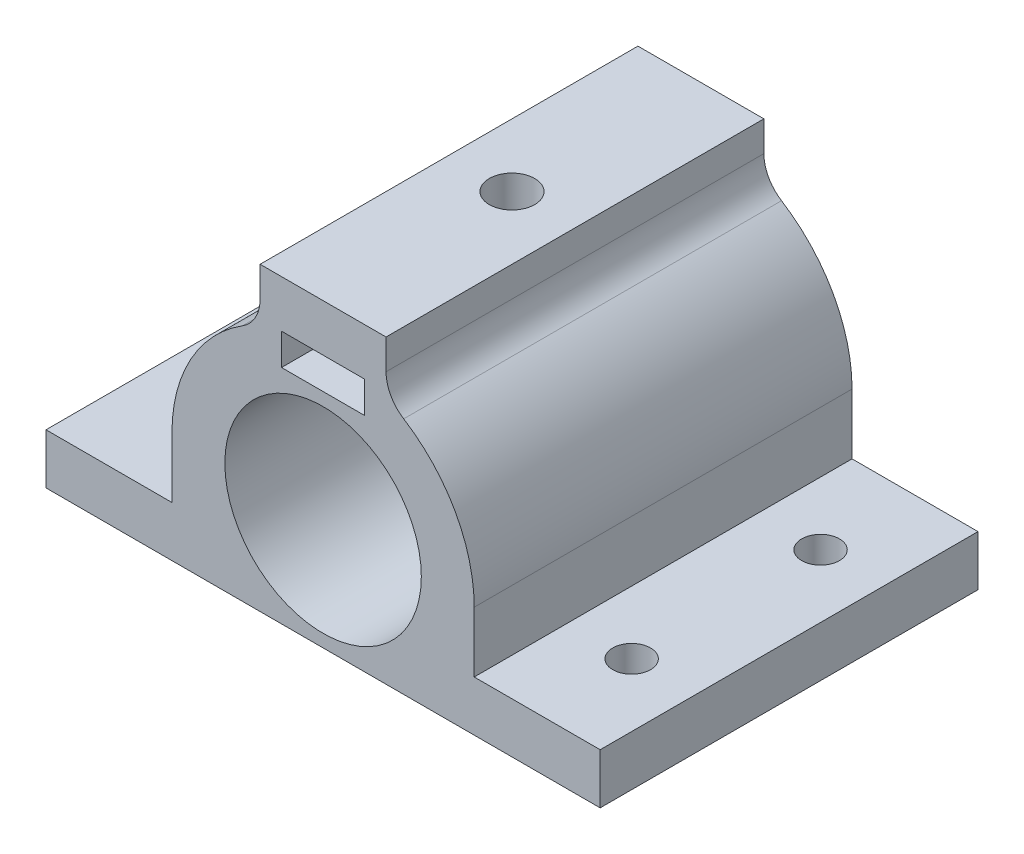
from build123d import *

# Parameters (mm, degrees)
ESBO_O1_W                = 6.6
ESBO_O1_H                = 2.5
RESSALTO_EXTRUS_O1_DEPTH = 30
ESBO_O2_R                = 1.5
CORTE_EXTRUS_O1_DEPTH    = 26
ESBO_O4_R                = 1.8
CORTE_EXTRUS_O2_DEPTH    = 16


with BuildPart() as part:
    # Esboço1 → Ressalto-extrusão1 (new body)
    with BuildSketch(Plane.XY):
        with BuildLine():
            Line((-12, 0), (-12, -4.8))
            Line((-12, -4.8), (-22, -4.8))
            Line((-22, -4.8), (-22, -8.8))
            Line((-22, -8.8), (22, -8.8))
            Line((22, -8.8), (22, -4.8))
            Line((22, -4.8), (12, -4.8))
            Line((12, -4.8), (12, 0))
            ThreePointArc((12, 0), (10.507140429, 5.796550698), (6.4, 10.150862032))
            ThreePointArc((6.4, 10.150862032), (5.373214893, 11.239439866), (5, 12.68857754))
            Line((5, 12.68857754), (5, 15.080826084))
            Line((5, 15.080826084), (-5, 15.080826084))
            Line((-5, 15.080826084), (-5, 12.68857754))
            ThreePointArc((-5, 12.68857754), (-5.373214893, 11.239439866), (-6.4, 10.150862032))
            ThreePointArc((-6.4, 10.150862032), (-10.507140429, 5.796550698), (-12, 0))
        make_face()
        with Locations((0, 10.080826084)):
            Rectangle(ESBO_O1_W, ESBO_O1_H, mode=Mode.SUBTRACT)
        with BuildLine():
            ThreePointArc((7.8, 0), (0, 7.8), (-7.8, 0))
            ThreePointArc((-7.8, 0), (0, -7.8), (7.8, 0))
        make_face(mode=Mode.SUBTRACT)
    extrude(amount=RESSALTO_EXTRUS_O1_DEPTH)

    # Esboço2 → Corte-extrusão1 (cut)
    with BuildSketch(Plane(origin=(0, -4.8, 0), x_dir=(1, 0, 0), z_dir=(0, 1, 0))):
        with Locations((-17, -7.5)):
            Circle(ESBO_O2_R)
        with Locations((-17, -22.5)):
            Circle(ESBO_O2_R)
        with Locations((17, -22.5)):
            Circle(ESBO_O2_R)
        with Locations((17, -7.5)):
            Circle(ESBO_O2_R)
    extrude(amount=-CORTE_EXTRUS_O1_DEPTH, mode=Mode.SUBTRACT)

    # Esboço4 → Corte-extrusão2 (cut)
    with BuildSketch(Plane(origin=(0, 15.080826084, 0), x_dir=(1, 0, 0), z_dir=(0, 1, 0))):
        with Locations((0, -15)):
            Circle(ESBO_O4_R)
    extrude(amount=-CORTE_EXTRUS_O2_DEPTH, mode=Mode.SUBTRACT)


solid = part.part
